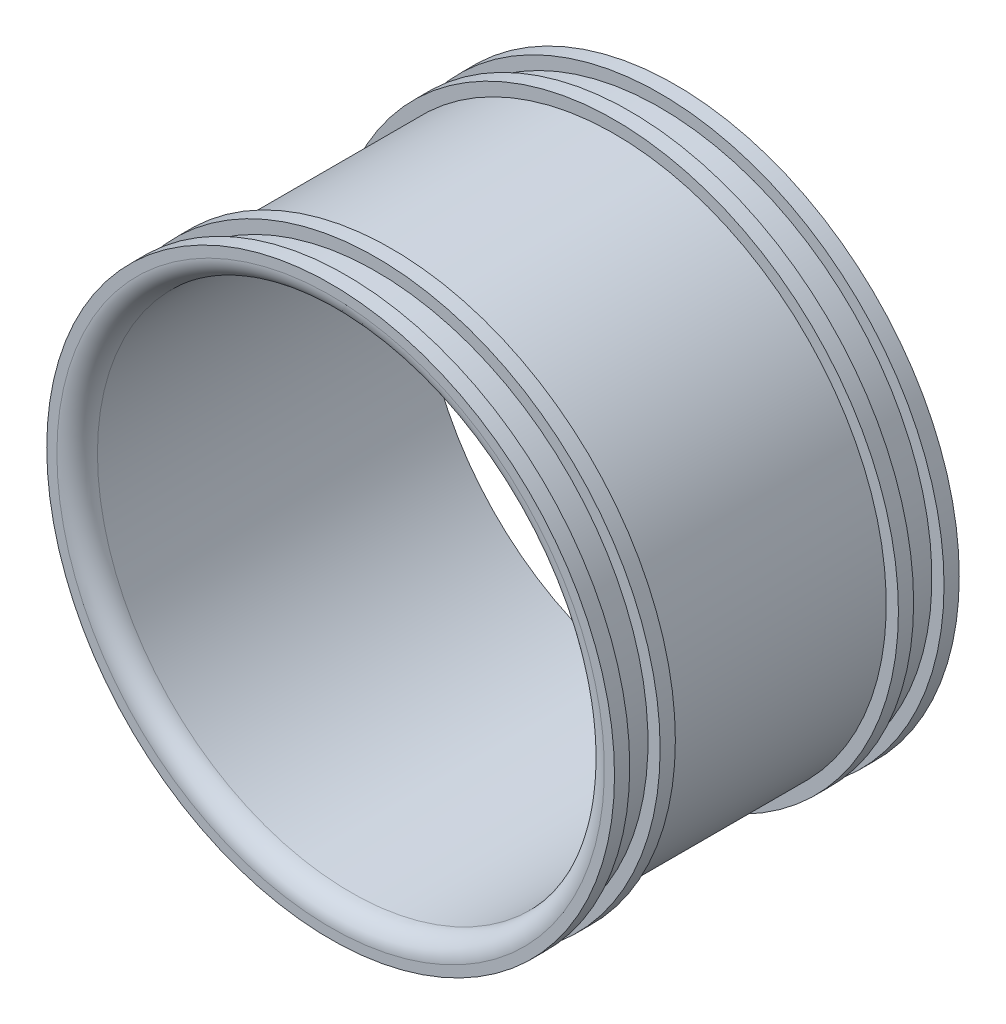
from build123d import *


with BuildPart() as part:
    # Sketch1 → Revolve1 (revolve)
    with BuildSketch(Plane.XZ):
        with BuildLine():
            Line((25, 0), (28, 0))
            Line((28, 0), (28, 1.5))
            Line((28, 1.5), (26.8, 1.5))
            Line((26.8, 1.5), (26.8, 4.5))
            Line((26.8, 4.5), (28, 4.5))
            Line((28, 4.5), (28, 6))
            Line((28, 6), (26.8, 6))
            Line((26.8, 6), (26.8, 28))
            Line((26.8, 28), (28, 28))
            Line((28, 28), (28, 29.5))
            Line((28, 29.5), (26.8, 29.5))
            Line((26.8, 29.5), (26.8, 32.5))
            Line((26.8, 32.5), (28, 32.5))
            Line((28, 32.5), (28, 33.999996833))
            Line((28, 33.999996833), (27, 33.999996833))
            ThreePointArc((27, 33.999996833), (25.585786438, 33.414213562), (25, 32))
            Line((25, 32), (25, 0))
        make_face()
    revolve(axis=Axis((0, 0, 34), (0, 0, -1)))


solid = part.part
